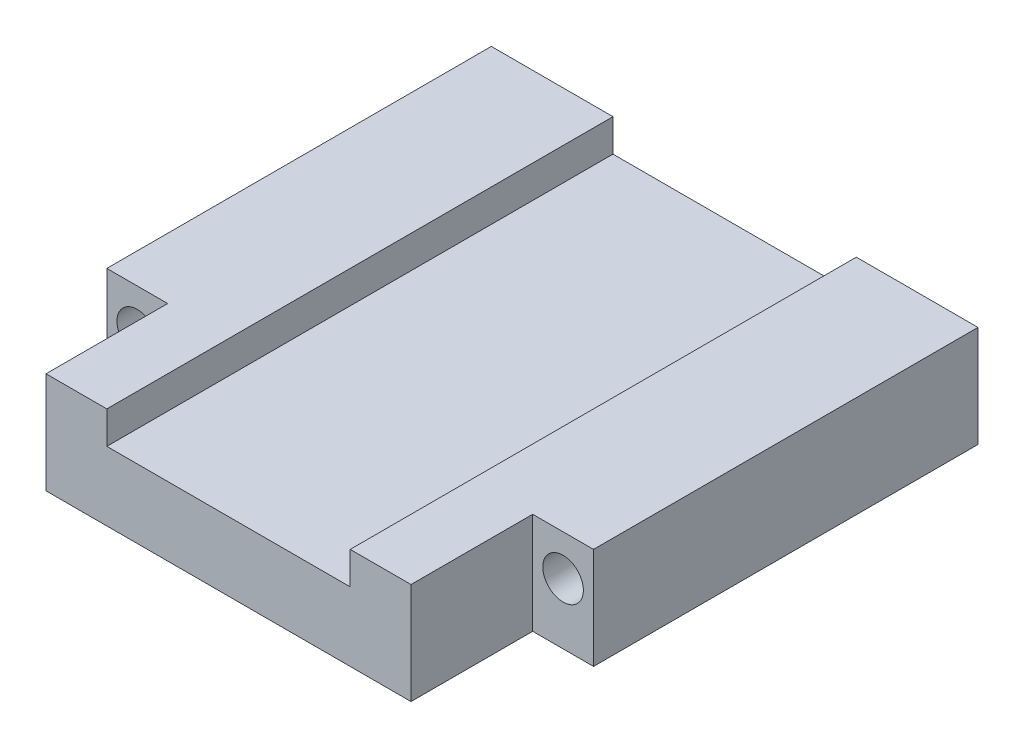
from build123d import *

# Parameters (mm, degrees)
SKETCH1_W                           = 38.1
SKETCH1_H                           = 7.9375
BOSS_EXTRUDE1_DEPTH                 = 39.624
SKETCH2_W                           = 19.05
SKETCH2_H                           = 2.54
CUT_EXTRUDE1_DEPTH                  = 45.144250504
F_1_8_0_125_CLEARANCE_DOWEL_HOLE1_D = 3.175
SKETCH6_W                           = 4.7625
SKETCH6_H                           = 7.9375
CUT_EXTRUDE2_DEPTH                  = 9.525


with BuildPart() as part:
    # Sketch1 → Boss-Extrude1 (new body)
    with BuildSketch(Plane.XY):
        Rectangle(SKETCH1_W, SKETCH1_H)
    extrude(amount=BOSS_EXTRUDE1_DEPTH)

    # Sketch2 → Cut-Extrude1 (cut, through all)
    with BuildSketch(Plane.XY.offset(39.624)):
        with Locations((0, 2.69875)):
            Rectangle(SKETCH2_W, SKETCH2_H)
    extrude(amount=-CUT_EXTRUDE1_DEPTH, mode=Mode.SUBTRACT)

    # 1/8 (0.125) Clearance Dowel Hole1 (through all)
    with Locations(Plane(origin=(0, 0, 0), x_dir=(-1, 0, 0), z_dir=(0, 0, -1))):
        with Locations((-16.66875, 0.79375), (16.66875, 0.79375)):
            Hole(F_1_8_0_125_CLEARANCE_DOWEL_HOLE1_D / 2)

    # Sketch6 → Cut-Extrude2 (cut)
    with BuildSketch(Plane.XY.offset(39.624)):
        with Locations((-16.66875, 0)):
            Rectangle(SKETCH6_W, SKETCH6_H)
        with Locations((16.66875, 0)):
            Rectangle(SKETCH6_W, SKETCH6_H)
    extrude(amount=-CUT_EXTRUDE2_DEPTH, mode=Mode.SUBTRACT)


solid = part.part
